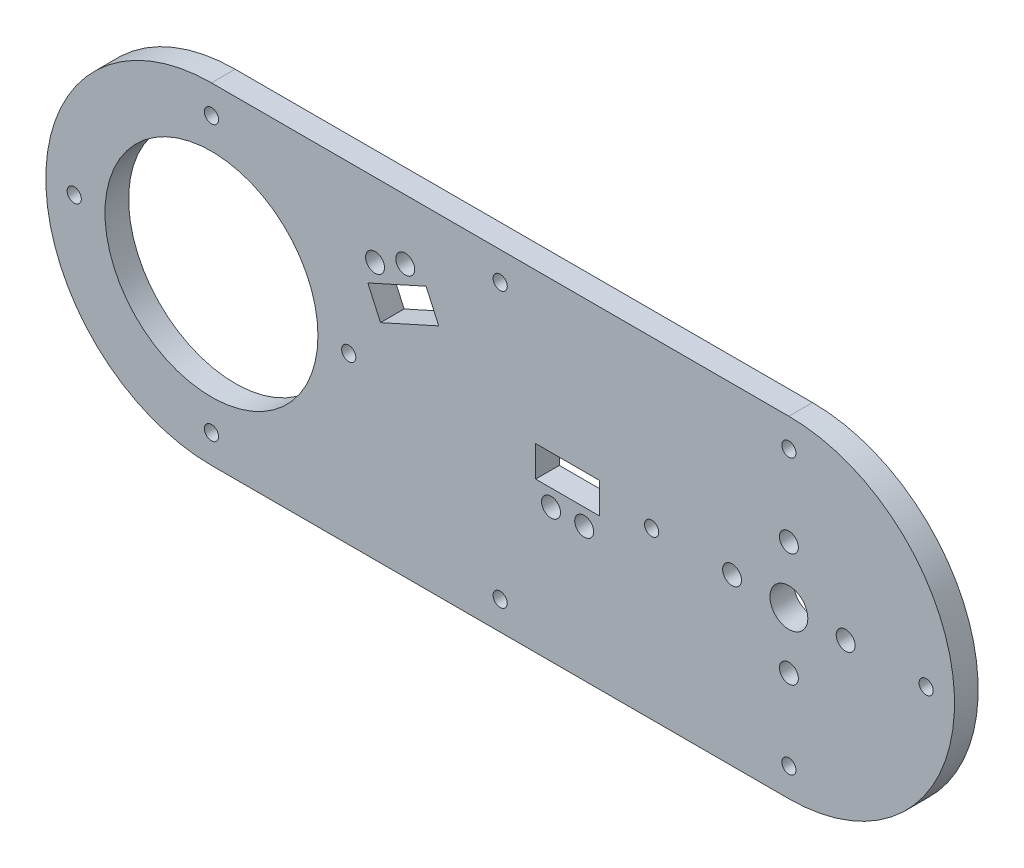
from build123d import *

# Parameters (mm, degrees)
SKETCH1_R           = 4
SKETCH1_R_2         = 22.5
SKETCH1_R_3         = 1.5
SKETCH1_R_4         = 2
SKETCH1_W           = 13.5
SKETCH1_H           = 6.5
BOSS_EXTRUDE1_DEPTH = 5


with BuildPart() as part:
    # Sketch1 → Boss-Extrude1 (new body)
    with BuildSketch(Plane.XY):
        with BuildLine():
            Line((61, -35), (-61, -35))
            ThreePointArc((-61, -35), (-96, 0), (-61, 35))
            Line((-61, 35), (61, 35))
            ThreePointArc((61, 35), (96, 0), (61, -35))
        make_face()
        with Locations((61, 0)):
            Circle(SKETCH1_R, mode=Mode.SUBTRACT)
        with Locations((-61, 0)):
            Circle(SKETCH1_R_2, mode=Mode.SUBTRACT)
        with Locations((-61, -29)):
            Circle(SKETCH1_R_3, mode=Mode.SUBTRACT)
        with Locations((-61, 29)):
            Circle(SKETCH1_R_3, mode=Mode.SUBTRACT)
        with Locations((61, 29)):
            Circle(SKETCH1_R_3, mode=Mode.SUBTRACT)
        with Locations((61, -29)):
            Circle(SKETCH1_R_3, mode=Mode.SUBTRACT)
        with Locations((0, 29)):
            Circle(SKETCH1_R_3, mode=Mode.SUBTRACT)
        with Locations((-90, 0)):
            Circle(SKETCH1_R_3, mode=Mode.SUBTRACT)
        with Locations((-32, 0)):
            Circle(SKETCH1_R_3, mode=Mode.SUBTRACT)
        with Locations((90, 0)):
            Circle(SKETCH1_R_3, mode=Mode.SUBTRACT)
        with Locations((32, 0)):
            Circle(SKETCH1_R_3, mode=Mode.SUBTRACT)
        with Locations((61, 12)):
            Circle(SKETCH1_R_4, mode=Mode.SUBTRACT)
        with Locations((61, -12)):
            Circle(SKETCH1_R_4, mode=Mode.SUBTRACT)
        with Locations((49, 0)):
            Circle(SKETCH1_R_4, mode=Mode.SUBTRACT)
        with Locations((73, 0)):
            Circle(SKETCH1_R_4, mode=Mode.SUBTRACT)
        with Locations((10.75, -6.75)):
            Circle(SKETCH1_R_4, mode=Mode.SUBTRACT)
        with Locations((17.75, -6.75)):
            Circle(SKETCH1_R_4, mode=Mode.SUBTRACT)
        with Locations((-20.05615201, 22.318183434)):
            Circle(SKETCH1_R_4, mode=Mode.SUBTRACT)
        with Locations((-26.436477609, 19.438696457)):
            Circle(SKETCH1_R_4, mode=Mode.SUBTRACT)
        with Locations((0, -29)):
            Circle(SKETCH1_R_3, mode=Mode.SUBTRACT)
        with Locations((14.25, 0)):
            Rectangle(SKETCH1_W, SKETCH1_H, mode=Mode.SUBTRACT)
        Polygon((-27.959028149, 14.911628989), (-25.285218813, 8.987040933), (-12.980305157, 14.540337246), (-15.654114493, 20.464925302), align=None, mode=Mode.SUBTRACT)
    extrude(amount=BOSS_EXTRUDE1_DEPTH)


solid = part.part
